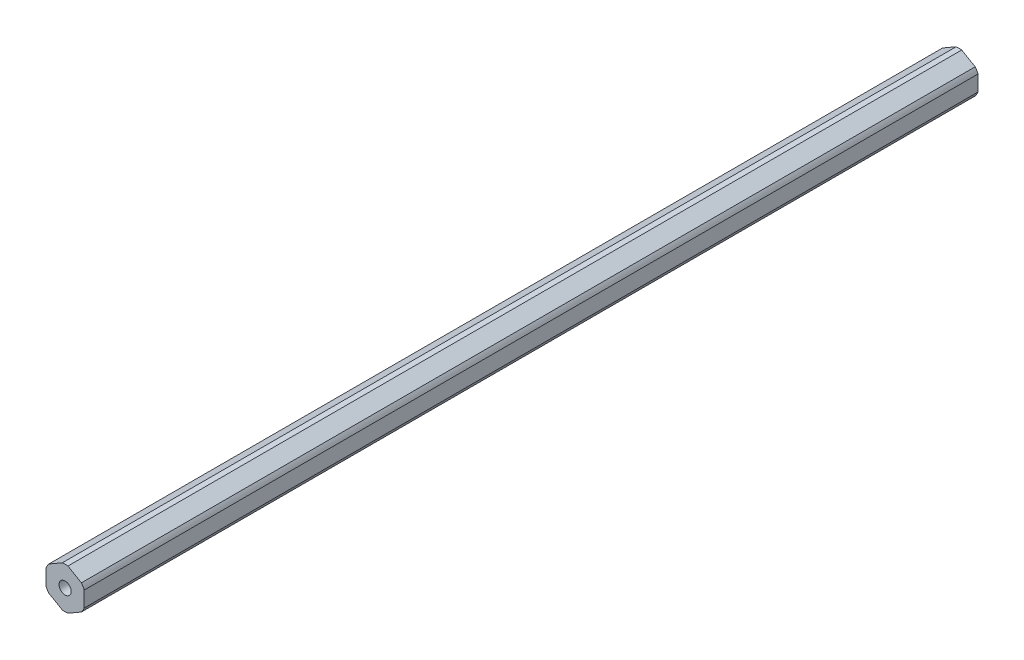
from build123d import *

# Parameters (mm, degrees)
BOSS_EXTRUDE1_DEPTH                  = 148.5265
F_10_32_TAPPED_HOLE1_D               = 4.0386
F_10_32_TAPPED_HOLE1_DEPTH           = 12.02944
F_10_32_TAPPED_HOLE1_TIP             = 1.213317848
F_10_32_TAPPED_HOLE1_ON_FACE_2_D     = 4.0386
F_10_32_TAPPED_HOLE1_ON_FACE_2_DEPTH = 12.02944
F_10_32_TAPPED_HOLE1_ON_FACE_2_TIP   = 1.213317848


with BuildPart() as part:
    # Sketch1 → Boss-Extrude1 (new, symmetric)
    with BuildSketch(Plane.XY):
        with BuildLine():
            ThreePointArc((0.93173274, 6.79441227), (0, 6.858), (-0.93173274, 6.79441227))
            Line((-0.93173274, 6.79441227), (-5.41826726, 4.204110358))
            ThreePointArc((-5.41826726, 4.204110358), (-5.939202219, 3.429), (-6.35, 2.590301913))
            Line((-6.35, 2.590301913), (-6.35, -2.590301913))
            ThreePointArc((-6.35, -2.590301913), (-5.939202219, -3.429), (-5.41826726, -4.204110358))
            Line((-5.41826726, -4.204110358), (-0.93173274, -6.79441227))
            ThreePointArc((-0.93173274, -6.79441227), (0, -6.858), (0.93173274, -6.79441227))
            Line((0.93173274, -6.79441227), (5.41826726, -4.204110358))
            ThreePointArc((5.41826726, -4.204110358), (5.939202219, -3.429), (6.35, -2.590301913))
            Line((6.35, -2.590301913), (6.35, 2.590301913))
            ThreePointArc((6.35, 2.590301913), (5.939202219, 3.429), (5.41826726, 4.204110358))
            Line((5.41826726, 4.204110358), (0.93173274, 6.79441227))
        make_face()
    extrude(amount=BOSS_EXTRUDE1_DEPTH, both=True)

    # #10-32 Tapped Hole1
    with Locations(Plane(origin=(0, 0, -148.5265), x_dir=(-1, 0, 0), z_dir=(0, 0, -1))):
        with Locations((0, 0)):
            Hole(F_10_32_TAPPED_HOLE1_D / 2, depth=F_10_32_TAPPED_HOLE1_DEPTH)
            with Locations((0, 0, -(F_10_32_TAPPED_HOLE1_DEPTH + F_10_32_TAPPED_HOLE1_TIP / 2))):  # 118° drill point
                Cone(0, F_10_32_TAPPED_HOLE1_D / 2, F_10_32_TAPPED_HOLE1_TIP, mode=Mode.SUBTRACT)

    # #10-32 Tapped Hole1 on face 2
    with Locations(Plane.XY.offset(148.5265)):
        with Locations((0, 0)):
            Hole(F_10_32_TAPPED_HOLE1_ON_FACE_2_D / 2, depth=F_10_32_TAPPED_HOLE1_ON_FACE_2_DEPTH)
            with Locations((0, 0, -(F_10_32_TAPPED_HOLE1_ON_FACE_2_DEPTH + F_10_32_TAPPED_HOLE1_ON_FACE_2_TIP / 2))):  # 118° drill point
                Cone(0, F_10_32_TAPPED_HOLE1_ON_FACE_2_D / 2, F_10_32_TAPPED_HOLE1_ON_FACE_2_TIP, mode=Mode.SUBTRACT)


solid = part.part
